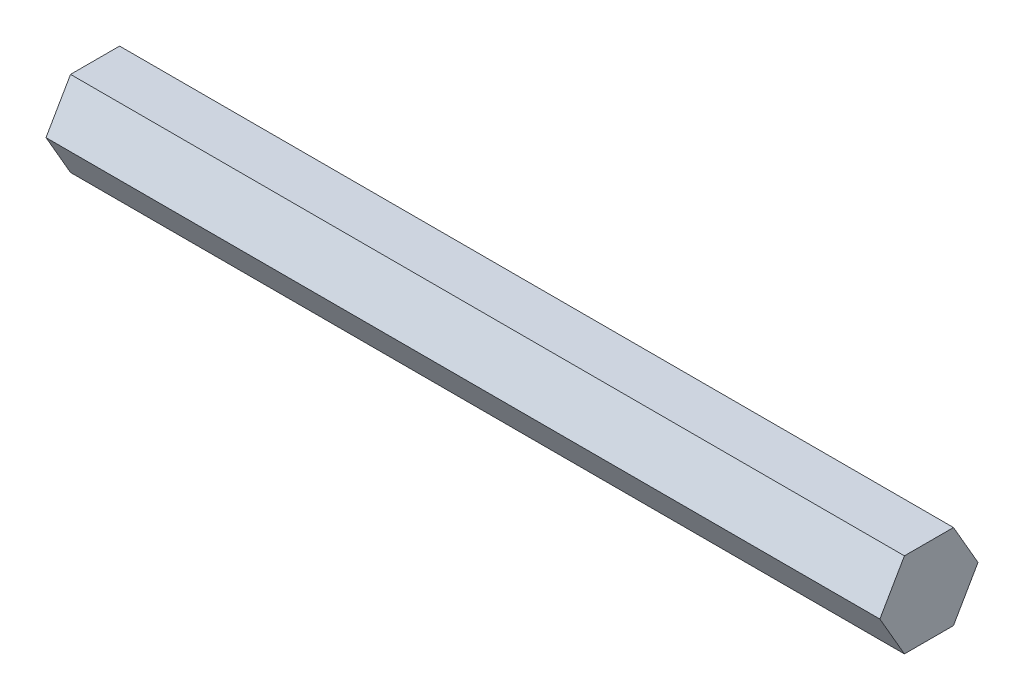
from build123d import *

# Parameters (mm, degrees)
SALIENTE_EXTRUIR1_DEPTH = 124.64


with BuildPart() as part:
    # Croquis1 → Saliente-Extruir1 (new body)
    with BuildSketch(Plane(origin=(0, 0, 0), x_dir=(0, 0, -1), z_dir=(1, 0, 0))):
        Polygon((7.332348419, 0), (3.666174209, 6.35), (-3.666174209, 6.35), (-7.332348419, 0), (-3.666174209, -6.35), (3.666174209, -6.35), align=None)
    extrude(amount=SALIENTE_EXTRUIR1_DEPTH)


solid = part.part
